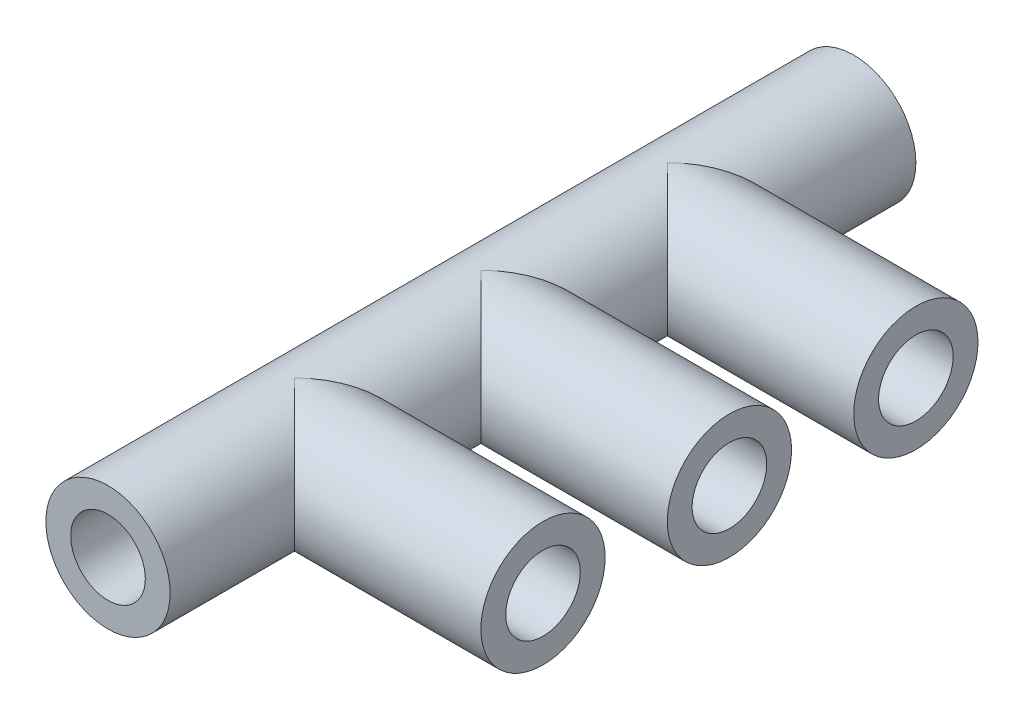
from build123d import *

# Parameters (mm, degrees)
ESQUISSE1_R        = 5
BOSS_EXTRU_1_DEPTH = 60
ESQUISSE2_R        = 5
BOSS_EXTRU_2_DEPTH = 20
COQUE1_START       = -1e-07
COQUE1_OUTLINE_R   = 3
COQUE1_DEPTH       = 20.0000001
COQUE1_2_OUTLINE_R = 3
COQUE1_2_DEPTH     = 60


with BuildPart() as part:
    # Esquisse1 → Boss.-Extru.1 (new body)
    with BuildSketch(Plane.XY):
        Circle(ESQUISSE1_R)
    extrude(amount=BOSS_EXTRU_1_DEPTH)

    # Esquisse2 → Boss.-Extru.2 (add)
    with BuildSketch(Plane(origin=(0, 0, 0), x_dir=(0, 0, -1), z_dir=(1, 0, 0))):
        with Locations((-15, 0)):
            Circle(ESQUISSE2_R)
        with Locations((-30, 0)):
            Circle(ESQUISSE2_R)
        with Locations((-45, 0)):
            Circle(ESQUISSE2_R)
    extrude(amount=BOSS_EXTRU_2_DEPTH)

    # Coque1: read off the stored shape, not the designer's step
    # Coque1 outline → Coque1 (cut)
    with BuildSketch(Plane.YZ.offset(COQUE1_START)):
        with Locations((0, 15)):
            Circle(COQUE1_OUTLINE_R)
        with Locations((0, 30)):
            Circle(COQUE1_OUTLINE_R)
        with Locations((0, 45)):
            Circle(COQUE1_OUTLINE_R)
    extrude(amount=COQUE1_DEPTH, mode=Mode.SUBTRACT)

    # Coque1 2 outline → Coque1 2 (cut)
    with BuildSketch(Plane.XY):
        Circle(COQUE1_2_OUTLINE_R)
    extrude(amount=COQUE1_2_DEPTH, mode=Mode.SUBTRACT)


solid = part.part
